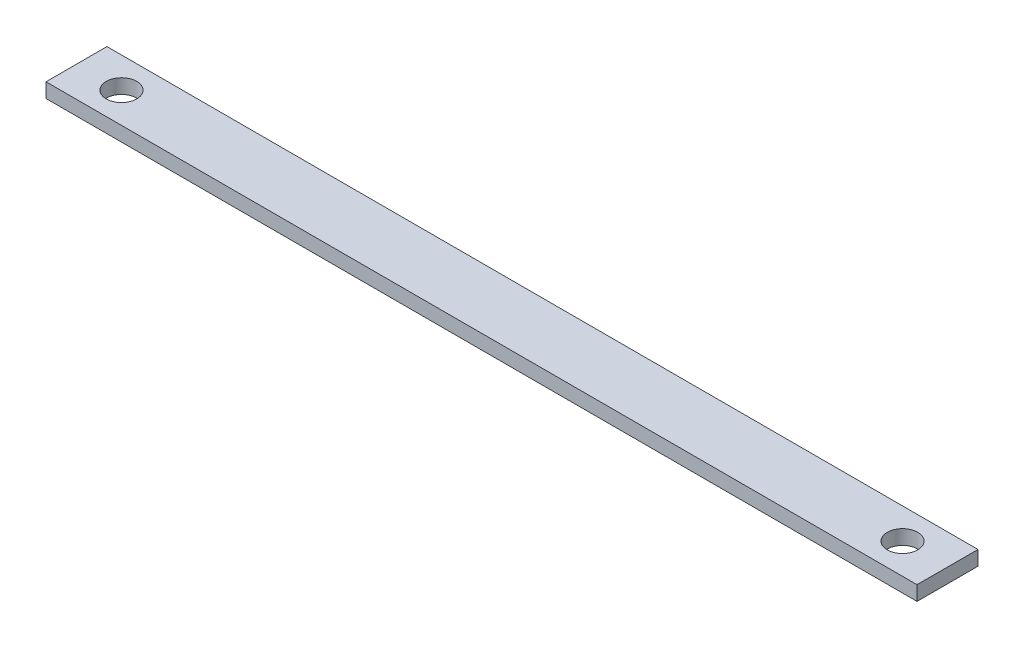
from build123d import *

# Parameters (mm, degrees)
ESQUISSE1_W             = 600
ESQUISSE1_H             = 42
BOSS_EXTRU_1_DEPTH      = 10
ESQUISSE2_R             = 10.5
ENL_V_MAT_EXTRU_1_DEPTH = 20


with BuildPart() as part:
    # Esquisse1 → Boss.-Extru.1 (new body)
    with BuildSketch(Plane(origin=(0, 0, 0), x_dir=(1, 0, 0), z_dir=(0, 1, 0))):
        Rectangle(ESQUISSE1_W, ESQUISSE1_H)
    extrude(amount=BOSS_EXTRU_1_DEPTH)

    # Esquisse2 → Enlèv. mat.-Extru.1 (cut)
    with BuildSketch(Plane(origin=(0, 10, 0), x_dir=(1, 0, 0), z_dir=(0, 1, 0))):
        with Locations((-269, 0)):
            Circle(ESQUISSE2_R)
        with Locations((269, 0)):
            Circle(ESQUISSE2_R)
    extrude(amount=-ENL_V_MAT_EXTRU_1_DEPTH, mode=Mode.SUBTRACT)


solid = part.part
